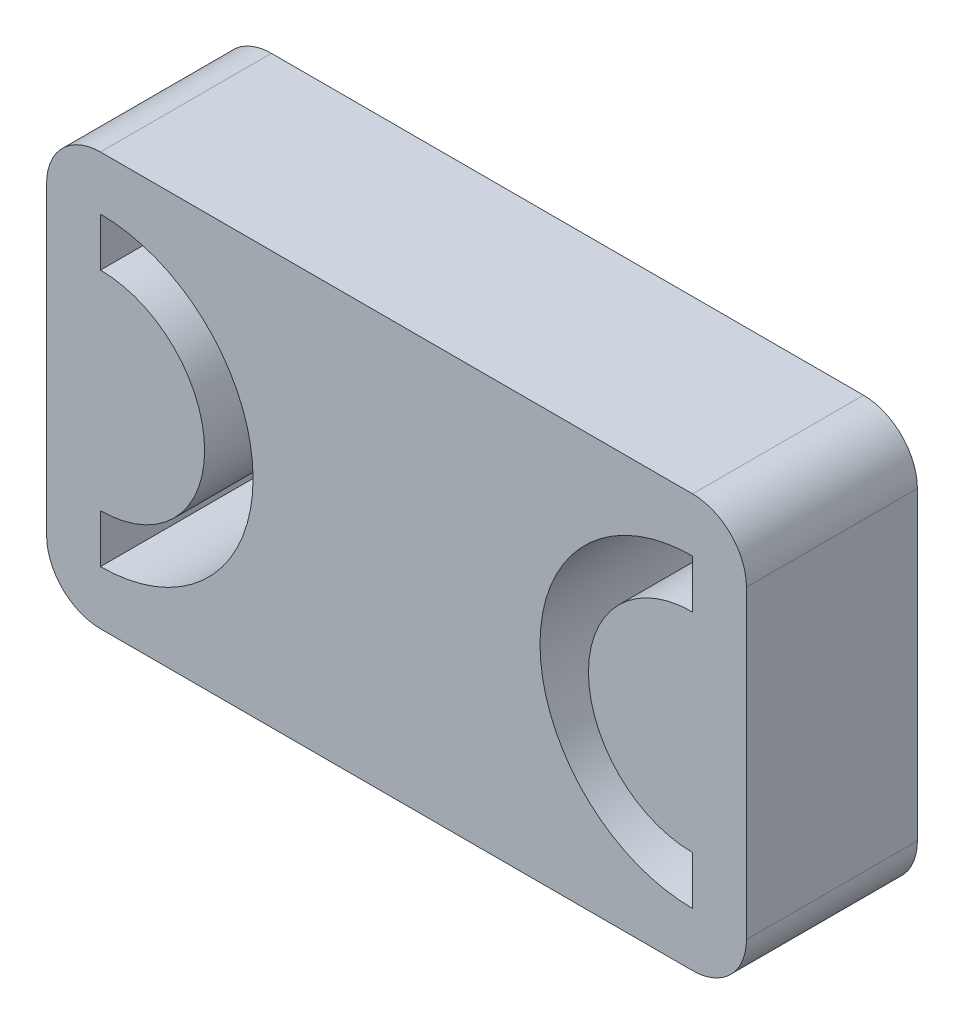
from build123d import *

# Parameters (mm, degrees)
BOSS_EXTRUDE2_DEPTH = 1.5875
FILLET2_R           = 1


with BuildPart() as part:
    # Sketch1 → Boss-Extrude2 (new, symmetric)
    with BuildSketch(Plane.XY):
        with BuildLine():
            Line((-6.5, -1.935), (-6.5, -3.702326971))
            ThreePointArc((-6.5, -3.702326971), (-6.004381337, -3.801687055), (-5.5, -3.835))
            Line((-5.5, -3.835), (5.5, -3.835))
            ThreePointArc((5.5, -3.835), (6.004381337, -3.801687055), (6.5, -3.702326971))
            Line((6.5, -3.702326971), (6.5, -1.935))
            Line((6.5, -1.935), (6.5, 1.935))
            Line((6.5, 1.935), (6.5, 3.702326971))
            ThreePointArc((6.5, 3.702326971), (6.004381337, 3.801687055), (5.5, 3.835))
            Line((5.5, 3.835), (-5.5, 3.835))
            ThreePointArc((-5.5, 3.835), (-6.004381337, 3.801687055), (-6.5, 3.702326971))
            Line((-6.5, 3.702326971), (-6.5, 1.935))
            Line((-6.5, 1.935), (-6.5, -1.935))
        make_face()
        with BuildLine():
            Line((-5.5, 2.835), (-5.5, 1.935))
            ThreePointArc((-5.5, 1.935), (-3.565, 0), (-5.5, -1.935))
            Line((-5.5, -1.935), (-5.5, -2.835))
            ThreePointArc((-5.5, -2.835), (-2.665, 0), (-5.5, 2.835))
        make_face(mode=Mode.SUBTRACT)
        with BuildLine():
            Line((5.5, -1.935), (5.5, -2.835))
            ThreePointArc((5.5, -2.835), (2.665, 0), (5.5, 2.835))
            Line((5.5, 2.835), (5.5, 1.935))
            ThreePointArc((5.5, 1.935), (3.565, 0), (5.5, -1.935))
        make_face(mode=Mode.SUBTRACT)
    extrude(amount=BOSS_EXTRUDE2_DEPTH, both=True)

    # Fillet2
    fillet2_edges = [part.edges().sort_by_distance(p)[0] for p in [
        (6.5, -3.702326971, 0),
        (-6.5, -3.702326971, 0),
        (6.5, 3.702326971, 0),
        (-6.5, 3.702326971, 0),
    ]]
    fillet(fillet2_edges, radius=FILLET2_R - 0.0001)  # a hair under: the kernel refuses the full size


solid = part.part
